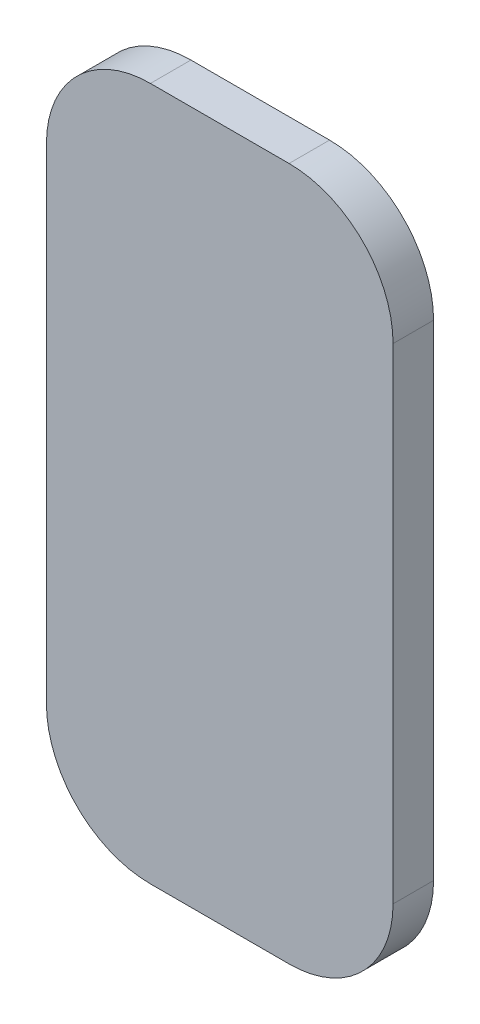
from build123d import *

# Parameters (mm, degrees)
SKETCH1_W          = 10
SKETCH1_H          = 20
BASE_FLANGE1_DEPTH = 1.1684
FILLET1_R          = 3


# Sheet-metal steps are written as plain solids
with BuildPart() as part:
    # Sketch1 → Base-Flange1 (new body)
    with BuildSketch(Plane.XY):
        with Locations((5, 10)):
            Rectangle(SKETCH1_W, SKETCH1_H)
    extrude(amount=-BASE_FLANGE1_DEPTH)

    # Fillet1
    fillet1_edges = [part.edges().sort_by_distance(p)[0] for p in [
        (0, 20, -0.5842),
        (10, 20, -0.5842),
        (10, 0, -0.5842),
        (0, 0, -0.5842),
    ]]
    fillet(fillet1_edges, radius=FILLET1_R)


solid = part.part
